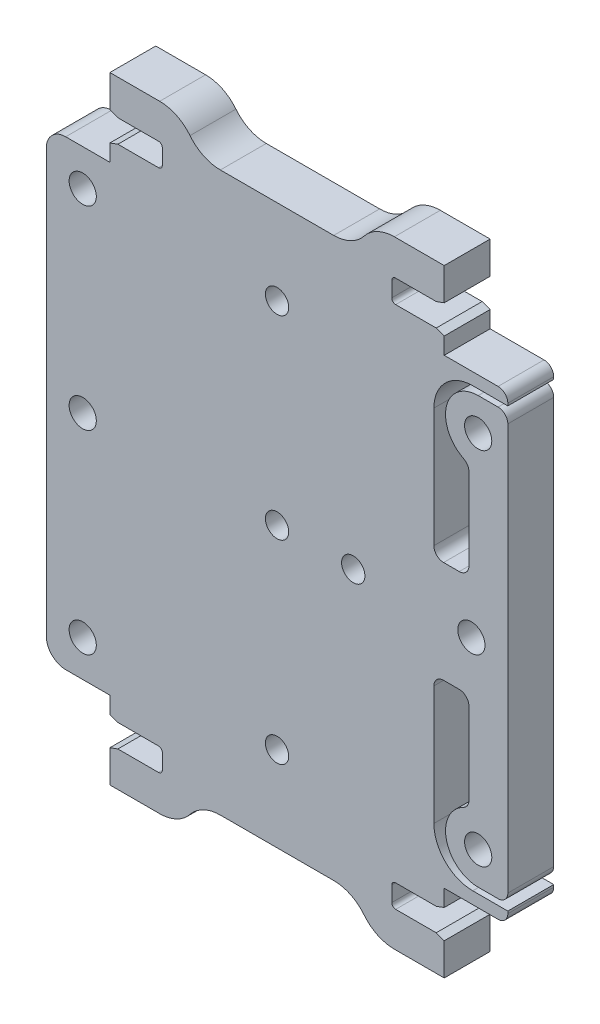
from build123d import *
from OCP.BRepFilletAPI import BRepFilletAPI_MakeChamfer

# Parameters (mm, degrees)
SKETCH1_W           = 60.325
SKETCH1_H           = 60.325
SKETCH1_R           = 1.778
SKETCH1_R_2         = 1.524
BOSS_EXTRUDE1_DEPTH = 6
CUT_EXTRUDE1_DEPTH  = 44.076128105
FILLET7_R           = 1.27
FILLET8_R           = 1.27
FILLET9_R           = 2.54
FILLET15_R          = 5.08
SKETCH4_W           = 2.54
SKETCH4_H           = 1.5875
BOSS_EXTRUDE2_DEPTH = 6
SKETCH6_W           = 12.7
SKETCH6_H           = 6.35
BOSS_EXTRUDE3_DEPTH = 6
FILLET10_R          = 2.54
FILLET11_R          = 2.54
BOSS_EXTRUDE4_DEPTH = 6
FILLET12_R          = 5.08
FILLET13_R          = 5.08
CUT_EXTRUDE2_REACH  = 52.712
SKETCH9_W           = 6.858
SKETCH9_H           = 2.9972
CHAMFER1_SIZE       = 0.381
CHAMFER1_SIZE2      = 1.046788897
FILLET14_R          = 0.508


with BuildPart() as part:
    # Sketch1 → Boss-Extrude1 (new body)
    with BuildSketch(Plane.XY):
        Rectangle(SKETCH1_W, SKETCH1_H)
        with Locations((26.289, 23.5585)):
            Circle(SKETCH1_R, mode=Mode.SUBTRACT)
        with Locations(Location((26.289, -23.5585, 0), (0, 0, 180))):
            Circle(SKETCH1_R, mode=Mode.SUBTRACT)
        with Locations((-25.4, 25.4)):
            Circle(SKETCH1_R, mode=Mode.SUBTRACT)
        with Locations((-25.4, -25.4)):
            Circle(SKETCH1_R, mode=Mode.SUBTRACT)
        with Locations((0, 25.4)):
            Circle(SKETCH1_R_2, mode=Mode.SUBTRACT)
        Circle(SKETCH1_R_2, mode=Mode.SUBTRACT)
        with Locations((0, -25.4)):
            Circle(SKETCH1_R_2, mode=Mode.SUBTRACT)
        with Locations((-25.4, 0)):
            Circle(SKETCH1_R, mode=Mode.SUBTRACT)
        with Locations((9.95934, 0)):
            Circle(SKETCH1_R_2, mode=Mode.SUBTRACT)
        with Locations((25.4, 0)):
            Circle(SKETCH1_R, mode=Mode.SUBTRACT)
    extrude(amount=BOSS_EXTRUDE1_DEPTH)

    # Sketch5 → Cut-Extrude1 (cut, through all)
    with BuildSketch(Plane.XY.offset(6)):
        with BuildLine():
            Line((20.4978, 23.5585), (20.4978, 6.6675))
            Line((20.4978, 6.6675), (25.0825, 6.6675))
            Line((25.0825, 6.6675), (25.0825, 19.465413928))
            ThreePointArc((25.0825, 19.465413928), (22.065552787, 24.167999366), (26.289, 27.8257))
            Line((26.289, 27.8257), (30.1625, 27.8257))
            Line((30.1625, 27.8257), (30.1625, 28.5877))
            Line((30.1625, 28.5877), (23.417563983, 28.5877))
            ThreePointArc((23.417563983, 28.5877), (21.28065408, 26.46615689), (20.4978, 23.5585))
        make_face()
    cut_extrude1 = extrude(amount=-CUT_EXTRUDE1_DEPTH, mode=Mode.SUBTRACT)

    # Fillet7
    fillet7_edges = [part.edges().sort_by_distance(p)[0] for p in [
        (30.1625, 27.8257, 3),
        (25.0825, 19.465413928, 3),
        (25.0825, 6.6675, 3),
        (20.4978, 6.6675, 3),
        (30.1625, 30.1625, 3),
    ]]
    fillet(fillet7_edges, radius=FILLET7_R)

    # Mirror1: Cut-Extrude1 across plane
    add(cut_extrude1.mirror(Plane.ZX), mode=Mode.SUBTRACT)

    # Fillet8
    fillet8_edges = [part.edges().sort_by_distance(p)[0] for p in [
        (20.4978, -6.6675, 3),
        (25.0825, -6.6675, 3),
        (25.0825, -19.465413928, 3),
        (30.1625, -27.8257, 3),
        (30.1625, -30.1625, 3),
    ]]
    fillet(fillet8_edges, radius=FILLET8_R)

    # Fillet9
    fillet9_edges = [part.edges().sort_by_distance(p)[0] for p in [
        (-30.1625, 30.1625, 3),
        (-30.1625, -30.1625, 3),
    ]]
    fillet(fillet9_edges, radius=FILLET9_R)

    # Fillet15
    fillet15_edges = [part.edges().sort_by_distance(p)[0] for p in [
        (23.417563983, -28.5877, 3),
        (23.417563983, 28.5877, 3),
    ]]
    fillet(fillet15_edges, radius=FILLET15_R)

    # Sketch4 → Boss-Extrude2 (add)
    with BuildSketch(Plane.XY.offset(6)):
        with Locations((20.58162, 30.95625)):
            Rectangle(SKETCH4_W, SKETCH4_H)
        with Locations((20.58162, -30.95625)):
            Rectangle(SKETCH4_W, SKETCH4_H)
        with Locations((-20.58162, 30.95625)):
            Rectangle(SKETCH4_W, SKETCH4_H)
        with Locations((-20.58162, -30.95625)):
            Rectangle(SKETCH4_W, SKETCH4_H)
    extrude(amount=-BOSS_EXTRUDE2_DEPTH)

    # Sketch6 → Boss-Extrude3 (add)
    with BuildSketch(Plane.XY.offset(6)):
        with Locations((0, 33.3375)):
            Rectangle(SKETCH6_W, SKETCH6_H)
    boss_extrude3 = extrude(amount=-BOSS_EXTRUDE3_DEPTH)

    # Fillet10
    fillet10_edges = [part.edges().sort_by_distance(p)[0] for p in [
        (6.35, 30.1625, 3),
        (6.35, 36.5125, 3),
        (-6.35, 36.5125, 3),
        (-6.35, 30.1625, 3),
    ]]
    fillet(fillet10_edges, radius=FILLET10_R)

    # Mirror2: Boss-Extrude3 across plane
    add(boss_extrude3.mirror(Plane.ZX))

    # Fillet11
    fillet11_edges = [part.edges().sort_by_distance(p)[0] for p in [
        (-6.35, -36.5125, 3),
        (-6.35, -30.1625, 3),
        (6.35, -30.1625, 3),
        (6.35, -36.5125, 3),
    ]]
    fillet(fillet11_edges, radius=FILLET11_R)

    # Sketch7 → Boss-Extrude4 (add)
    with BuildSketch(Plane.XY.offset(6)):
        Polygon((-21.85162, 30.1625), (21.85162, 30.1625), (21.85162, 36.5125), (21.85162, 40.3225), (10.42162, 40.3225), (10.42162, 36.5125), (-10.42162, 36.5125), (-10.42162, 40.3225), (-21.85162, 40.3225), (-21.85162, 36.5125), align=None)
        Polygon((-21.85162, -30.1625), (21.85162, -30.1625), (21.85162, -36.5125), (21.85162, -40.3225), (10.42162, -40.3225), (10.42162, -36.5125), (-10.42162, -36.5125), (-10.42162, -40.3225), (-21.85162, -40.3225), (-21.85162, -36.5125), align=None)
    extrude(amount=-BOSS_EXTRUDE4_DEPTH)

    # Fillet12
    # the kernel refuses this fillet: 5.08 mm, written as the material it takes off along each edge
    with BuildSketch(Plane(origin=(-10.42162, -40.3225, 18.296722124), x_dir=(0, 1, 0), z_dir=(0, 0, -1)), Plane(origin=(10.42162, 40.3225, 18.296722124), x_dir=(0, -1, 0), z_dir=(0, 0, -1))) as fillet12_piece_1:
        with BuildLine():
            CenterArc((5.08, -4.91868885), FILLET12_R, 104.477512186, 75.522487814)
            Line((0, -4.91868885), (-0.1016, -4.91868885))
            Line((-0.1016, -4.91868885), (-0.1016, 0))
            Line((-0.1016, 0), (0, 0.1016))
            ThreePointArc((0, 0.1016), (1.905, 0.1016), (3.7846, 0.098373777))
            Line((3.7846, 0.098373777), (3.81, 0))
        make_face()
    extrude(amount=30.593444248, mode=Mode.SUBTRACT)
    with BuildSketch(Plane(origin=(10.42162, -40.3225, 18.296722124), x_dir=(1, 0, 0), z_dir=(0, 0, -1)), Plane(origin=(-10.42162, 40.3225, 18.296722124), x_dir=(-1, 0, 0), z_dir=(0, 0, -1))) as fillet12_piece_2:
        with BuildLine():
            CenterArc((4.91868885, -5.08), FILLET12_R, 90, 75.522487814)
            Line((0, -3.81), (-0.098373777, -3.7846))
            ThreePointArc((-0.098373777, -3.7846), (-0.1016, -1.905), (-0.1016, 0))
            Line((-0.1016, 0), (0, 0.1016))
            Line((0, 0.1016), (4.91868885, 0.1016))
            Line((4.91868885, 0.1016), (4.91868885, 0))
        make_face()
    extrude(amount=30.593444248, mode=Mode.SUBTRACT)

    # Fillet13
    fillet13_edges = [part.edges().sort_by_distance(p)[0] for p in [
        (10.42162, 36.5125, 3),
        (-10.42162, 36.5125, 3),
        (-10.42162, -36.5125, 3),
        (10.42162, -36.5125, 3),
    ]]
    fillet(fillet13_edges, radius=FILLET13_R)

    # Sketch9 → Cut-Extrude2 (cut, up to next)
    with BuildSketch(Plane(origin=(0, 0, 0), x_dir=(-1, 0, 0), z_dir=(0, 0, -1)), mode=Mode.PRIVATE) as cut_extrude2_sk1:
        with Locations((-18.42262, 34.2265)):
            Rectangle(SKETCH9_W, SKETCH9_H)
    cut_extrude2_tool1 = extrude(cut_extrude2_sk1.sketch, amount=-CUT_EXTRUDE2_REACH, mode=Mode.PRIVATE) & part.part
    # Sketch9 → Cut-Extrude2 (cut, up to next)
    with BuildSketch(Plane(origin=(0, 0, 0), x_dir=(-1, 0, 0), z_dir=(0, 0, -1)), mode=Mode.PRIVATE) as cut_extrude2_sk2:
        with Locations((18.42262, 34.2265)):
            Rectangle(SKETCH9_W, SKETCH9_H)
    cut_extrude2_tool2 = extrude(cut_extrude2_sk2.sketch, amount=-CUT_EXTRUDE2_REACH, mode=Mode.PRIVATE) & part.part
    # Sketch9 → Cut-Extrude2 (cut, up to next)
    with BuildSketch(Plane(origin=(0, 0, 0), x_dir=(-1, 0, 0), z_dir=(0, 0, -1)), mode=Mode.PRIVATE) as cut_extrude2_sk3:
        with Locations((-18.42262, -34.2265)):
            Rectangle(SKETCH9_W, SKETCH9_H)
    cut_extrude2_tool3 = extrude(cut_extrude2_sk3.sketch, amount=-CUT_EXTRUDE2_REACH, mode=Mode.PRIVATE) & part.part
    # Sketch9 → Cut-Extrude2 (cut, up to next)
    with BuildSketch(Plane(origin=(0, 0, 0), x_dir=(-1, 0, 0), z_dir=(0, 0, -1)), mode=Mode.PRIVATE) as cut_extrude2_sk4:
        with Locations((18.42262, -34.2265)):
            Rectangle(SKETCH9_W, SKETCH9_H)
    cut_extrude2_tool4 = extrude(cut_extrude2_sk4.sketch, amount=-CUT_EXTRUDE2_REACH, mode=Mode.PRIVATE) & part.part
    add(cut_extrude2_tool1.solids().sort_by_distance((18.42262, 34.2265, 0))[0], mode=Mode.SUBTRACT)
    add(cut_extrude2_tool2.solids().sort_by_distance((-18.42262, 34.2265, 0))[0], mode=Mode.SUBTRACT)
    add(cut_extrude2_tool3.solids().sort_by_distance((18.42262, -34.2265, 0))[0], mode=Mode.SUBTRACT)
    add(cut_extrude2_tool4.solids().sort_by_distance((-18.42262, -34.2265, 0))[0], mode=Mode.SUBTRACT)

    # Chamfer1: one chamfer whose edges measure the first distance from different faces: ONE call of the kernel's chamfer builder (chamfer() names one face for all edges)
    chamfer1_edges_1 = [part.edges().sort_by_distance(p)[0] for p in [
        (21.85162, 32.7279, 3),
    ]]
    chamfer1_side_1 = [part.faces().sort_by_distance(p)[0] for p in [
        (21.85162, 31.4452, 3),
    ]]
    chamfer1_edges_2 = [part.edges().sort_by_distance(p)[0] for p in [
        (21.85162, 35.7251, 3),
    ]]
    chamfer1_side_2 = [part.faces().sort_by_distance(p)[0] for p in [
        (21.85162, 38.0238, 3),
    ]]
    chamfer1_edges_3 = [part.edges().sort_by_distance(p)[0] for p in [
        (-21.85162, 35.7251, 3),
    ]]
    chamfer1_side_3 = [part.faces().sort_by_distance(p)[0] for p in [
        (-21.85162, 38.0238, 3),
    ]]
    chamfer1_edges_4 = [part.edges().sort_by_distance(p)[0] for p in [
        (-21.85162, 32.7279, 3),
    ]]
    chamfer1_side_4 = [part.faces().sort_by_distance(p)[0] for p in [
        (-21.85162, 31.4452, 3),
    ]]
    chamfer1_edges_5 = [part.edges().sort_by_distance(p)[0] for p in [
        (21.85162, -35.7251, 3),
    ]]
    chamfer1_side_5 = [part.faces().sort_by_distance(p)[0] for p in [
        (21.85162, -38.0238, 3),
    ]]
    chamfer1_edges_6 = [part.edges().sort_by_distance(p)[0] for p in [
        (21.85162, -32.7279, 3),
    ]]
    chamfer1_side_6 = [part.faces().sort_by_distance(p)[0] for p in [
        (21.85162, -31.4452, 3),
    ]]
    chamfer1_edges_7 = [part.edges().sort_by_distance(p)[0] for p in [
        (-21.85162, -32.7279, 3),
    ]]
    chamfer1_side_7 = [part.faces().sort_by_distance(p)[0] for p in [
        (-21.85162, -31.4452, 3),
    ]]
    chamfer1_edges_8 = [part.edges().sort_by_distance(p)[0] for p in [
        (-21.85162, -35.7251, 3),
    ]]
    chamfer1_side_8 = [part.faces().sort_by_distance(p)[0] for p in [
        (-21.85162, -38.0238, 3),
    ]]
    chamfer1 = BRepFilletAPI_MakeChamfer(part.part.solid().wrapped)
    for e in chamfer1_edges_1:
        chamfer1.Add(CHAMFER1_SIZE, CHAMFER1_SIZE2, e.wrapped, chamfer1_side_1[0].wrapped)  # the first distance lies on this face
    for e in chamfer1_edges_2:
        chamfer1.Add(CHAMFER1_SIZE, CHAMFER1_SIZE2, e.wrapped, chamfer1_side_2[0].wrapped)  # the first distance lies on this face
    for e in chamfer1_edges_3:
        chamfer1.Add(CHAMFER1_SIZE, CHAMFER1_SIZE2, e.wrapped, chamfer1_side_3[0].wrapped)  # the first distance lies on this face
    for e in chamfer1_edges_4:
        chamfer1.Add(CHAMFER1_SIZE, CHAMFER1_SIZE2, e.wrapped, chamfer1_side_4[0].wrapped)  # the first distance lies on this face
    for e in chamfer1_edges_5:
        chamfer1.Add(CHAMFER1_SIZE, CHAMFER1_SIZE2, e.wrapped, chamfer1_side_5[0].wrapped)  # the first distance lies on this face
    for e in chamfer1_edges_6:
        chamfer1.Add(CHAMFER1_SIZE, CHAMFER1_SIZE2, e.wrapped, chamfer1_side_6[0].wrapped)  # the first distance lies on this face
    for e in chamfer1_edges_7:
        chamfer1.Add(CHAMFER1_SIZE, CHAMFER1_SIZE2, e.wrapped, chamfer1_side_7[0].wrapped)  # the first distance lies on this face
    for e in chamfer1_edges_8:
        chamfer1.Add(CHAMFER1_SIZE, CHAMFER1_SIZE2, e.wrapped, chamfer1_side_8[0].wrapped)  # the first distance lies on this face
    add(Compound.cast(chamfer1.Shape()), mode=Mode.REPLACE)

    # Fillet14
    fillet14_edges = [part.edges().sort_by_distance(p)[0] for p in [
        (14.99362, 35.7251, 3),
        (14.99362, 32.7279, 3),
        (-14.99362, 32.7279, 3),
        (-14.99362, 35.7251, 3),
        (14.99362, -32.7279, 3),
        (14.99362, -35.7251, 3),
        (-14.99362, -35.7251, 3),
        (-14.99362, -32.7279, 3),
    ]]
    fillet(fillet14_edges, radius=FILLET14_R)


solid = part.part
